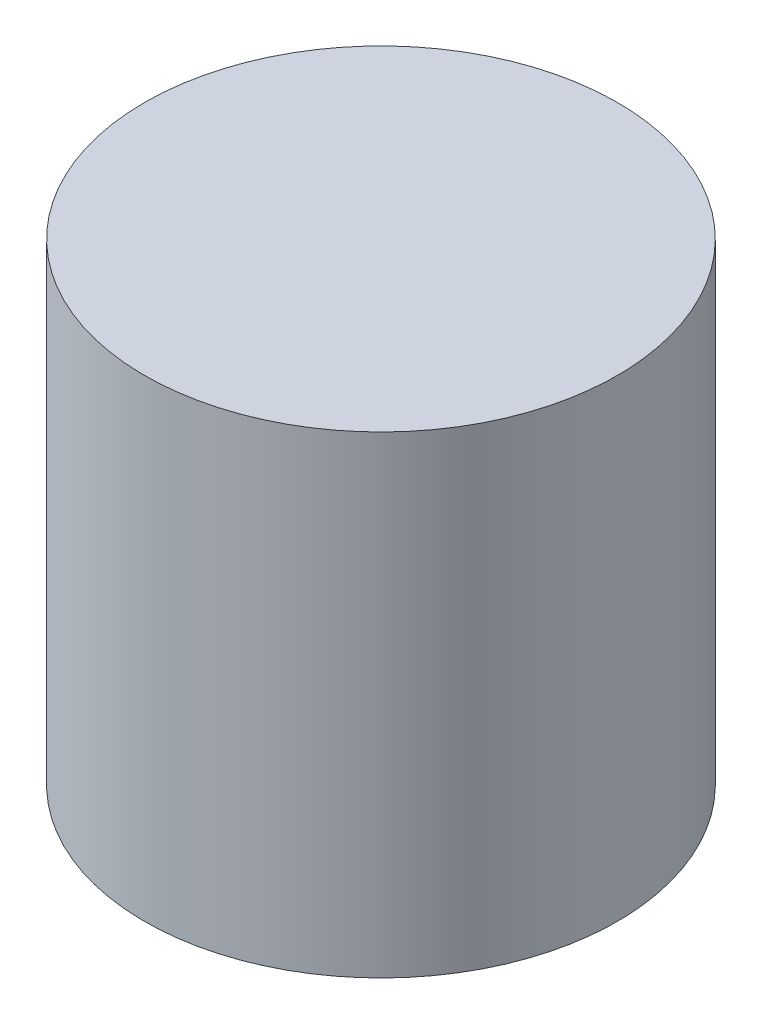
from build123d import *


with BuildPart() as part:
    # Sketch1 → Revolve1 (revolve)
    with BuildSketch(Plane.XY):
        Polygon((50.8, 50.8), (0, 50.8), (0, 44.45), (44.45, 44.45), (44.45, -44.45), (0, -44.45), (0, -50.8), (50.8, -50.8), align=None)
    revolve(axis=Axis((0, 50.8, 0), (0, -1, 0)))


solid = part.part
